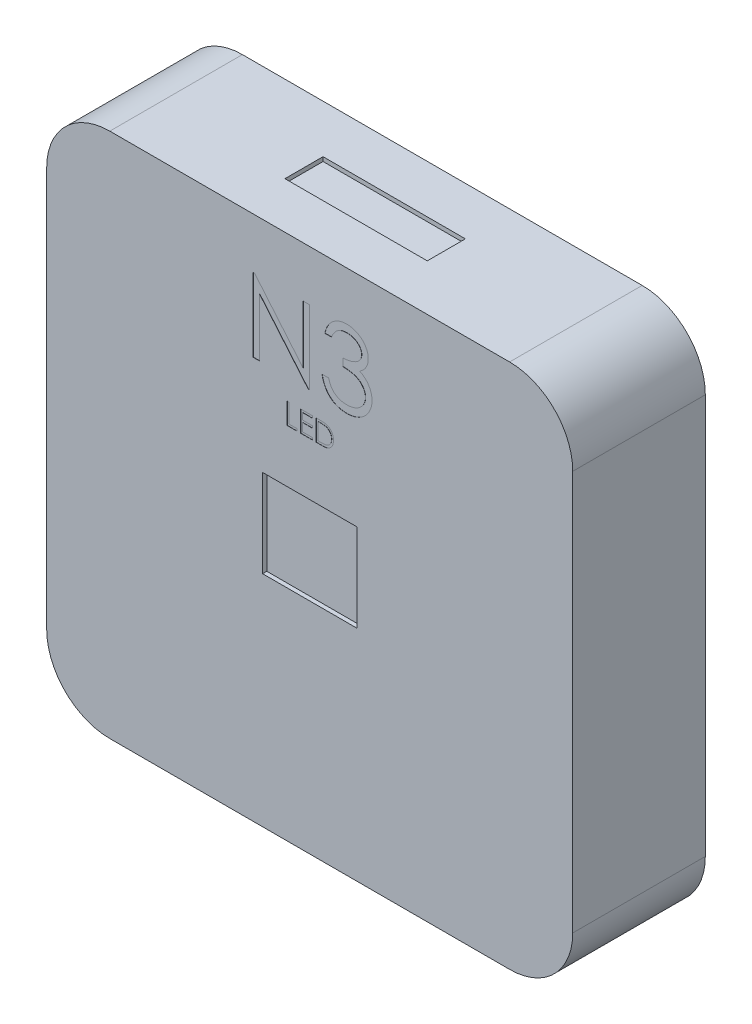
from build123d import *

# Parameters (mm, degrees)
SKETCH_1_W          = 25
SKETCH_1_H          = 25
EXTRUDE_1_DEPTH     = 6.3
FILLET_1_R          = 3
WRAP_START          = -0.01
WRAP_1_DEPTH        = 0.01
SKETCH_3_W          = 4.480069614
SKETCH_3_H          = 4.169910948
CUT_EXTRUDE_1_DEPTH = 0.2
SKETCH_4_W          = 6.124850416
SKETCH_4_H          = 1.704306202
CUT_EXTRUDE_2_DEPTH = 0.2
SKETCH_5_W          = 6.763965242
SKETCH_5_H          = 1.81082534
CUT_EXTRUDE_3_DEPTH = 0.2


# Read off the part's stored shape, not the designer's step: 包覆1
with BuildPart() as part:
    # 草图1 → 凸台-拉伸1 (new body)
    with BuildSketch(Plane.XY):
        Rectangle(SKETCH_1_W, SKETCH_1_H)
    extrude(amount=EXTRUDE_1_DEPTH)

    # 圆角1
    fillet_1_edges = [part.edges().sort_by_distance(p)[0] for p in [
        (12.5, -12.5, 3.15),
        (-12.5, -12.5, 3.15),
        (-12.5, 12.5, 3.15),
        (12.5, 12.5, 3.15),
    ]]
    fillet(fillet_1_edges, radius=FILLET_1_R)

    # 包覆1 outline → 包覆1 (cut)
    # profile 1 of 5: a face of its own
    with BuildSketch(Plane.XY.offset(6.3).offset(WRAP_START)):
        with BuildLine():
            add(Edge.make_bspline(
                [(0.509615385, 5.599487161), (0.527177953, 5.599360713), (0.561108743, 5.599116415), (0.610140871, 5.597567446), (0.65550766, 5.594827313), (0.697059905, 5.59083602), (0.73491168, 5.585935153), (0.768956997, 5.57979218), (0.799371895, 5.572538417), (0.818077449, 5.566354003), (0.826923077, 5.563429469)],
                knots=[0, 0, 0, 0, 0.164289216, 0.317405911, 0.458843612, 0.589366542, 0.707831319, 0.815770031, 0.912879903, 1, 1, 1, 1], degree=3))
            Line((0.509615385, 5.599487161), (0.307692308, 5.599487161))
            Line((0.307692308, 5.599487161), (0.307692308, 4.599487161))
            Line((0.307692308, 4.599487161), (0.617588141, 4.599487161))
            add(Edge.make_bspline(
                [(1.128205128, 5.086866969), (1.128025423, 5.074506615), (1.127671296, 5.050149247), (1.124491491, 5.014251848), (1.119869685, 4.979419399), (1.1127142, 4.945817771), (1.104027768, 4.913152565), (1.092895153, 4.881771924), (1.080142154, 4.851387979), (1.065270761, 4.822411557), (1.048944651, 4.794959165), (1.031424152, 4.769080443), (1.012727954, 4.745144665), (0.992677773, 4.723079347), (0.971532711, 4.702917753), (0.949154331, 4.684491463), (0.925484888, 4.668161019), (0.900630396, 4.653284702), (0.873865787, 4.640307458), (0.844684111, 4.629327455), (0.812960918, 4.620228422), (0.778774073, 4.612636738), (0.742064508, 4.606614651), (0.702796232, 4.602578539), (0.661029578, 4.59984913), (0.632349787, 4.59961016), (0.617588141, 4.599487161)],
                knots=[0, 0, 0, 0, 0.046080683, 0.0908068, 0.134295271, 0.177024386, 0.218822734, 0.260244116, 0.301079867, 0.341613894, 0.381583419, 0.420119591, 0.458074619, 0.494738488, 0.531194623, 0.566933698, 0.602712651, 0.638326606, 0.674853249, 0.713467371, 0.754441804, 0.797815361, 0.843989456, 0.89307157, 0.944963346, 1, 1, 1, 1], degree=3))
            add(Edge.make_bspline(
                [(0.826923077, 5.563429469), (0.838493002, 5.559020696), (0.861370486, 5.550303126), (0.89394395, 5.533858469), (0.924608339, 5.515226154), (0.953528095, 5.494381622), (0.980042616, 5.470734665), (1.00518773, 5.445289783), (1.027934794, 5.417121686), (1.048765735, 5.386814547), (1.067547352, 5.354725389), (1.083872826, 5.320915358), (1.09743111, 5.285556156), (1.108686318, 5.248746113), (1.117556734, 5.210404291), (1.123608714, 5.170486044), (1.127600426, 5.129149132), (1.128001583, 5.101099286), (1.128205128, 5.086866969)],
                knots=[0, 0, 0, 0, 0.061544966, 0.121694296, 0.181154855, 0.239875389, 0.298701942, 0.357647424, 0.417604843, 0.478494041, 0.540407051, 0.602344994, 0.665004328, 0.728559309, 0.793650542, 0.860534268, 0.929235961, 1, 1, 1, 1], degree=3))
        make_face()
        with BuildLine():
            add(Edge.make_bspline(
                [(0.512219551, 4.702051264), (0.528713371, 4.702122149), (0.560437028, 4.702258486), (0.606053599, 4.703454829), (0.647733426, 4.705409669), (0.685482429, 4.708145405), (0.719279293, 4.71176501), (0.74919465, 4.715800696), (0.775130438, 4.720828539), (0.790824563, 4.725385956), (0.798076923, 4.727491969)],
                knots=[0, 0, 0, 0, 0.171900665, 0.330627932, 0.475548836, 0.60674619, 0.725023803, 0.829742387, 0.92132282, 1, 1, 1, 1], degree=3))
            Line((0.512219551, 4.702051264), (0.397435897, 4.702051264))
            Line((0.397435897, 4.702051264), (0.397435897, 5.496923059))
            Line((0.397435897, 5.496923059), (0.467748397, 5.496923059))
            add(Edge.make_bspline(
                [(0.775040064, 5.468878187), (0.766654022, 5.471197166), (0.748822996, 5.476127953), (0.719726007, 5.481506631), (0.686978821, 5.486250773), (0.650436049, 5.490267356), (0.610139347, 5.493149448), (0.566057722, 5.49531268), (0.51817212, 5.496771718), (0.484977111, 5.496871349), (0.467748397, 5.496923059)],
                knots=[0, 0, 0, 0, 0.084318617, 0.179284514, 0.286582528, 0.405111483, 0.535592873, 0.67819021, 0.83297584, 1, 1, 1, 1], degree=3))
            add(Edge.make_bspline(
                [(1.038461538, 5.087067289), (1.038314885, 5.09876257), (1.038026783, 5.121738051), (1.034405551, 5.155449678), (1.029113678, 5.187872721), (1.021461196, 5.219009348), (1.011709517, 5.248920306), (0.999539619, 5.277440166), (0.985634871, 5.304870129), (0.96909106, 5.33057709), (0.950972319, 5.354889407), (0.930864354, 5.37716224), (0.909086629, 5.397446326), (0.885876672, 5.416057558), (0.860580357, 5.43224718), (0.833793589, 5.446729089), (0.805123397, 5.459019343), (0.785176912, 5.465556161), (0.775040064, 5.468878187)],
                knots=[0, 0, 0, 0, 0.070151176, 0.137812606, 0.203226247, 0.267174055, 0.330024003, 0.391794272, 0.453084399, 0.514333908, 0.574999993, 0.634865483, 0.694116315, 0.753441622, 0.8131258, 0.874079686, 0.936007013, 1, 1, 1, 1], degree=3))
            add(Edge.make_bspline(
                [(0.798076923, 4.727491969), (0.807205027, 4.7307067), (0.825243209, 4.737059378), (0.851209233, 4.748647281), (0.87542552, 4.762373587), (0.898314099, 4.777631379), (0.919550286, 4.794958809), (0.939385748, 4.813979091), (0.957780548, 4.834789027), (0.974544636, 4.857362787), (0.989547009, 4.881559872), (1.002538789, 4.907142396), (1.013924941, 4.933830056), (1.022861681, 4.962032672), (1.029866134, 4.991498118), (1.034827473, 5.022228464), (1.037917395, 5.054217973), (1.038277808, 5.075975723), (1.038461538, 5.087067289)],
                knots=[0, 0, 0, 0, 0.0624145, 0.123338231, 0.183124538, 0.241782995, 0.300578883, 0.359680075, 0.418881641, 0.479530664, 0.540850536, 0.602303396, 0.664463212, 0.727805723, 0.792894815, 0.859672328, 0.928464401, 1, 1, 1, 1], degree=3))
        make_face(mode=Mode.SUBTRACT)
    # profile 2 of 5: a face of its own
    with BuildSketch(Plane.XY.offset(6.3).offset(WRAP_START)):
        with BuildLine():
            add(Edge.make_bspline(
                [(0.717948718, 9.291794854), (0.726458269, 9.327027338), (0.743093744, 9.395903962), (0.777791318, 9.494311223), (0.815590573, 9.587434744), (0.860979677, 9.673530818), (0.910488432, 9.754329721), (0.967211153, 9.827998845), (1.028530876, 9.896411811), (1.096355825, 9.957125048), (1.167484487, 10.012102777), (1.242919106, 10.058977835), (1.321142, 10.099301988), (1.402695133, 10.132522219), (1.487821305, 10.157547743), (1.575750928, 10.175704549), (1.666714428, 10.187495663), (1.728462019, 10.188646426), (1.759815705, 10.189230751)],
                knots=[0, 0, 0, 0, 0.072625346, 0.141976611, 0.208984928, 0.27395687, 0.336889347, 0.398744953, 0.460115885, 0.520824923, 0.580994459, 0.640151928, 0.698622451, 0.757271081, 0.816426694, 0.876254048, 0.937165293, 1, 1, 1, 1], degree=3))
            Line((0.717948718, 9.291794854), (1.032051282, 9.291794854))
            add(Edge.make_bspline(
                [(1.764022436, 9.830256392), (1.724170768, 9.82886503), (1.646331192, 9.826147376), (1.534116275, 9.802344363), (1.429796941, 9.764366279), (1.350058274, 9.71903326), (1.2911757, 9.674282826), (1.249098762, 9.63520044), (1.207778251, 9.591767616), (1.169932574, 9.541309241), (1.131658598, 9.487242451), (1.096814036, 9.426818769), (1.062954344, 9.361614375), (1.042551794, 9.31551874), (1.032051282, 9.291794854)],
                knots=[0, 0, 0, 0, 0.122711942, 0.239684964, 0.351815855, 0.463766133, 0.520817793, 0.579448291, 0.640604145, 0.705297512, 0.773633881, 0.844669382, 0.920056508, 1, 1, 1, 1], degree=3))
            add(Edge.make_bspline(
                [(2.467948718, 9.281278027), (2.467534307, 9.299555772), (2.466709856, 9.335918479), (2.456312578, 9.389043548), (2.440688537, 9.440544493), (2.419208808, 9.490202304), (2.390458609, 9.537672578), (2.356052623, 9.583360027), (2.315084522, 9.627003806), (2.268139075, 9.667684125), (2.21772727, 9.706453362), (2.162477495, 9.739366999), (2.104055621, 9.767512061), (2.042396966, 9.790721563), (1.977301436, 9.808180852), (1.909074878, 9.820716693), (1.837587194, 9.828554348), (1.788815462, 9.829682764), (1.764022436, 9.830256392)],
                knots=[0, 0, 0, 0, 0.055274549, 0.109966094, 0.163247443, 0.218076185, 0.273300874, 0.3309093, 0.390994523, 0.454175953, 0.518861541, 0.583310532, 0.648516682, 0.715030887, 0.782502073, 0.852322685, 0.92492849, 1, 1, 1, 1], degree=3))
            add(Edge.make_bspline(
                [(1.570512821, 8.70846152), (1.613813986, 8.709196324), (1.698630333, 8.710635624), (1.822524638, 8.728043634), (1.94099795, 8.752124262), (2.051424692, 8.789009455), (2.152073405, 8.831849752), (2.239393007, 8.881701961), (2.312160154, 8.93711671), (2.370021226, 8.99894932), (2.413550455, 9.065264367), (2.445377252, 9.134381025), (2.464177578, 9.206905086), (2.466687245, 9.256399754), (2.467948718, 9.281278027)],
                knots=[0, 0, 0, 0, 0.110165553, 0.215787256, 0.318027435, 0.417573954, 0.511650488, 0.596162097, 0.672934533, 0.743669557, 0.810677001, 0.874058962, 0.936696302, 1, 1, 1, 1], degree=3))
            Line((1.570512821, 8.70846152), (1.570512821, 8.349487161))
            add(Edge.make_bspline(
                [(2.647435897, 7.609102546), (2.645905596, 7.641713885), (2.642852607, 7.706774293), (2.619544028, 7.802491867), (2.581205164, 7.89471528), (2.527532652, 7.98187107), (2.462196924, 8.062646971), (2.385832017, 8.134718454), (2.297803789, 8.194188545), (2.21678392, 8.235277201), (2.145018763, 8.263314276), (2.083603379, 8.281989241), (2.014846775, 8.297802897), (1.939580426, 8.312515168), (1.85723721, 8.325036516), (1.767906772, 8.335478332), (1.67157101, 8.343833373), (1.604879844, 8.347564468), (1.570512821, 8.349487161)],
                knots=[0, 0, 0, 0, 0.066909186, 0.13348544, 0.201035117, 0.27123434, 0.342879984, 0.41383613, 0.485976622, 0.560229557, 0.599884181, 0.64405484, 0.691891932, 0.744687524, 0.801491775, 0.862857698, 0.929328379, 1, 1, 1, 1], degree=3))
            add(Edge.make_bspline(
                [(1.756310096, 6.86871793), (1.789063599, 6.869333836), (1.853110246, 6.870538185), (1.946565105, 6.881613892), (2.035472553, 6.897744306), (2.118845478, 6.922657288), (2.197775986, 6.95343814), (2.271157635, 6.992086545), (2.339953742, 7.037431267), (2.403283147, 7.088970426), (2.460228654, 7.145391921), (2.510368168, 7.204404992), (2.552992829, 7.265760821), (2.587376407, 7.329798942), (2.614526958, 7.396254171), (2.633010158, 7.465313), (2.645861673, 7.536410267), (2.646908286, 7.584739236), (2.647435897, 7.609102546)],
                knots=[0, 0, 0, 0, 0.076071737, 0.148751715, 0.218402794, 0.285759581, 0.350598024, 0.414964045, 0.478069339, 0.541760676, 0.604349859, 0.664075021, 0.721463623, 0.777587128, 0.832644447, 0.887843511, 0.943460343, 1, 1, 1, 1], degree=3))
            add(Edge.make_bspline(
                [(1.171574519, 7.058020815), (1.191171096, 7.042912481), (1.230303759, 7.012742449), (1.29407199, 6.974240821), (1.361136876, 6.940879796), (1.43295155, 6.9153961), (1.50796632, 6.893818439), (1.587393686, 6.87969792), (1.670532903, 6.870009749), (1.727300666, 6.869154817), (1.756310096, 6.86871793)],
                knots=[0, 0, 0, 0, 0.118271305, 0.236177533, 0.355662933, 0.475904165, 0.600127342, 0.728608116, 0.861313476, 1, 1, 1, 1], degree=3))
            add(Edge.make_bspline(
                [(0.897435897, 7.541794854), (0.905619189, 7.51484584), (0.921536402, 7.462427669), (0.9486307, 7.386987363), (0.979498972, 7.31782931), (1.01261353, 7.254446188), (1.047391976, 7.196213785), (1.086306901, 7.144671916), (1.126476047, 7.097556714), (1.1567554, 7.071012102), (1.171574519, 7.058020815)],
                knots=[0, 0, 0, 0, 0.149770386, 0.29131641, 0.425966373, 0.552159574, 0.671527414, 0.786121629, 0.895325073, 1, 1, 1, 1], degree=3))
            Line((0.897435897, 7.541794854), (0.583333333, 7.541794854))
            add(Edge.make_bspline(
                [(1.750701122, 6.509743572), (1.713281822, 6.510611785), (1.639653116, 6.512320139), (1.531409618, 6.52399874), (1.428087919, 6.545328745), (1.329548321, 6.574032051), (1.235703284, 6.610423793), (1.146839179, 6.655742491), (1.062409286, 6.709053993), (0.983210335, 6.770987581), (0.909251767, 6.84026892), (0.842499043, 6.91812793), (0.78183925, 7.003125334), (0.728896611, 7.096248391), (0.681259658, 7.196293648), (0.642078702, 7.304542146), (0.607593133, 7.420026168), (0.591559669, 7.500503908), (0.583333333, 7.541794854)],
                knots=[0, 0, 0, 0, 0.06554117, 0.128963168, 0.190377136, 0.250092362, 0.308548432, 0.366397963, 0.424542189, 0.483169996, 0.5422434, 0.601739352, 0.662506002, 0.724855513, 0.789127829, 0.8563464, 0.926295235, 1, 1, 1, 1], degree=3))
            add(Edge.make_bspline(
                [(2.961538462, 7.639250783), (2.959743948, 7.590241062), (2.956163366, 7.49245226), (2.924159292, 7.347977538), (2.874546051, 7.206752036), (2.804089115, 7.071677197), (2.718221606, 6.945296816), (2.616064282, 6.832220507), (2.498777874, 6.735021902), (2.367972225, 6.653811674), (2.226255096, 6.588893752), (2.074679504, 6.543836309), (1.91542945, 6.51449031), (1.806222153, 6.511343441), (1.750701122, 6.509743572)],
                knots=[0, 0, 0, 0, 0.079648251, 0.158921676, 0.239619495, 0.32260943, 0.406034637, 0.487602095, 0.569684627, 0.653036145, 0.737435718, 0.822477816, 0.909747655, 1, 1, 1, 1], degree=3))
            add(Edge.make_bspline(
                [(2.752604167, 8.261145815), (2.769445509, 8.238088063), (2.802852405, 8.192350147), (2.844087939, 8.118813721), (2.881497053, 8.044462232), (2.910647272, 7.967302826), (2.933221139, 7.888229812), (2.949357172, 7.807107416), (2.959381312, 7.723869394), (2.960816864, 7.667556913), (2.961538462, 7.639250783)],
                knots=[0, 0, 0, 0, 0.12813551, 0.254172712, 0.378111645, 0.501712263, 0.623986309, 0.747095614, 0.872874637, 1, 1, 1, 1], degree=3))
            add(Edge.make_bspline(
                [(2.373297276, 8.5598237), (2.41052903, 8.541845528), (2.484295904, 8.506225571), (2.584846434, 8.436369813), (2.676124309, 8.355713466), (2.727028028, 8.292770813), (2.752604167, 8.261145815)],
                knots=[0, 0, 0, 0, 0.2538796, 0.503008917, 0.750291081, 1, 1, 1, 1], degree=3))
            add(Edge.make_bspline(
                [(2.782051282, 9.279875783), (2.780887691, 9.242868988), (2.778610724, 9.170452434), (2.759277018, 9.064730937), (2.726740755, 8.965089336), (2.681670993, 8.871108174), (2.623329443, 8.783383335), (2.552656746, 8.701717444), (2.469154084, 8.625748286), (2.405875146, 8.582228813), (2.373297276, 8.5598237)],
                knots=[0, 0, 0, 0, 0.128067549, 0.250608319, 0.370630166, 0.490072247, 0.610374764, 0.73431307, 0.863216504, 1, 1, 1, 1], degree=3))
            add(Edge.make_bspline(
                [(1.759815705, 10.189230751), (1.805498447, 10.187851521), (1.895867458, 10.185123145), (2.028630505, 10.160208709), (2.156657324, 10.120783576), (2.278546572, 10.066309849), (2.391765005, 9.999122536), (2.492501191, 9.919157799), (2.579389702, 9.827958498), (2.65228408, 9.727225933), (2.709359079, 9.619570424), (2.751445452, 9.508770267), (2.777067133, 9.395088296), (2.78038769, 9.318331016), (2.782051282, 9.279875783)],
                knots=[0, 0, 0, 0, 0.090254249, 0.178539792, 0.266093034, 0.354630978, 0.441886153, 0.525746915, 0.608113634, 0.690197273, 0.770821484, 0.848326181, 0.92401174, 1, 1, 1, 1], degree=3))
        make_face()
    # profile 3 of 5: a face of its own
    with BuildSketch(Plane.XY.offset(6.3).offset(WRAP_START)):
        Polygon((-2.626402244, 10.099487161), (-2.692307692, 10.099487161), (-2.692307692, 6.599487161), (-2.378205128, 6.599487161), (-2.378205128, 9.347884597), (-0.071514423, 6.599487161), (0, 6.599487161), (0, 10.099487161), (-0.314102564, 10.099487161), (-0.314102564, 7.344779629), align=None)
    # profile 4 of 5: a face of its own
    with BuildSketch(Plane.XY.offset(6.3).offset(WRAP_START)):
        Polygon((0.128205128, 5.599487161), (-0.435897436, 5.599487161), (-0.435897436, 4.599487161), (0.128205128, 4.599487161), (0.128205128, 4.702051264), (-0.346153846, 4.702051264), (-0.346153846, 5.086666648), (0.128205128, 5.086666648), (0.128205128, 5.189230751), (-0.346153846, 5.189230751), (-0.346153846, 5.496923059), (0.128205128, 5.496923059), align=None)
    # profile 5 of 5: a face of its own
    with BuildSketch(Plane.XY.offset(6.3).offset(WRAP_START)):
        Polygon((-0.987179487, 5.599487161), (-1.076923077, 5.599487161), (-1.076923077, 4.599487161), (-0.602564103, 4.599487161), (-0.602564103, 4.702051264), (-0.987179487, 4.702051264), align=None)
    extrude(amount=WRAP_1_DEPTH, mode=Mode.SUBTRACT)

    # 草图3 → 切除-拉伸1 (cut)
    with BuildSketch(Plane.XY.offset(6.3)):
        Rectangle(SKETCH_3_W, SKETCH_3_H)
    extrude(amount=-CUT_EXTRUDE_1_DEPTH, mode=Mode.SUBTRACT)

    # 草图4 → 切除-拉伸2 (cut)
    with BuildSketch(Plane.XZ.offset(12.5)):
        with Locations((0, 3.349723383)):
            Rectangle(SKETCH_4_W, SKETCH_4_H)
    extrude(amount=-CUT_EXTRUDE_2_DEPTH, mode=Mode.SUBTRACT)

    # 草图5 → 切除-拉伸3 (cut)
    with BuildSketch(Plane(origin=(0, 12.5, 0), x_dir=(1, 0, 0), z_dir=(0, 1, 0))):
        with Locations((0, -3.189944677)):
            Rectangle(SKETCH_5_W, SKETCH_5_H)
    extrude(amount=-CUT_EXTRUDE_3_DEPTH, mode=Mode.SUBTRACT)


solid = part.part
